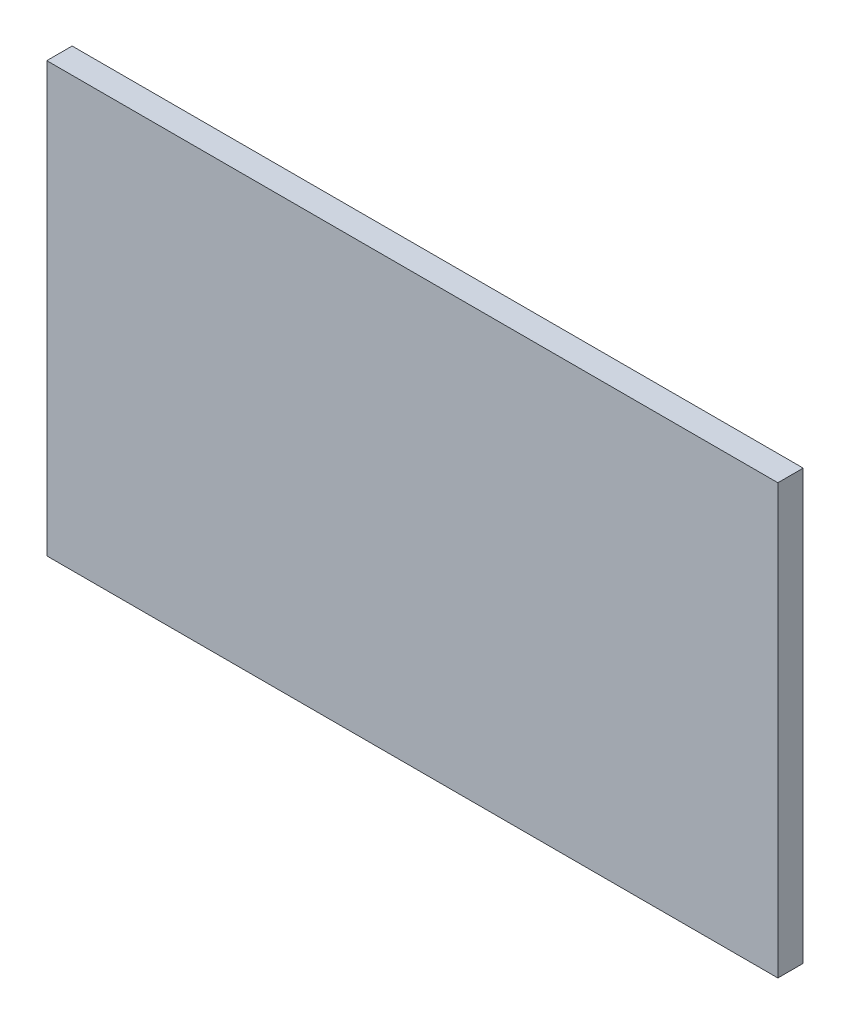
from build123d import *

# Parameters (mm, degrees)
ESQUISSE2_W        = 3750
ESQUISSE2_H        = 2200
BOSS_EXTRU_1_DEPTH = 130


with BuildPart() as part:
    # Esquisse2 → Boss.-Extru.1 (new body)
    with BuildSketch(Plane.XY):
        with Locations((1875, 1100)):
            Rectangle(ESQUISSE2_W, ESQUISSE2_H)
    extrude(amount=-BOSS_EXTRU_1_DEPTH)


solid = part.part
